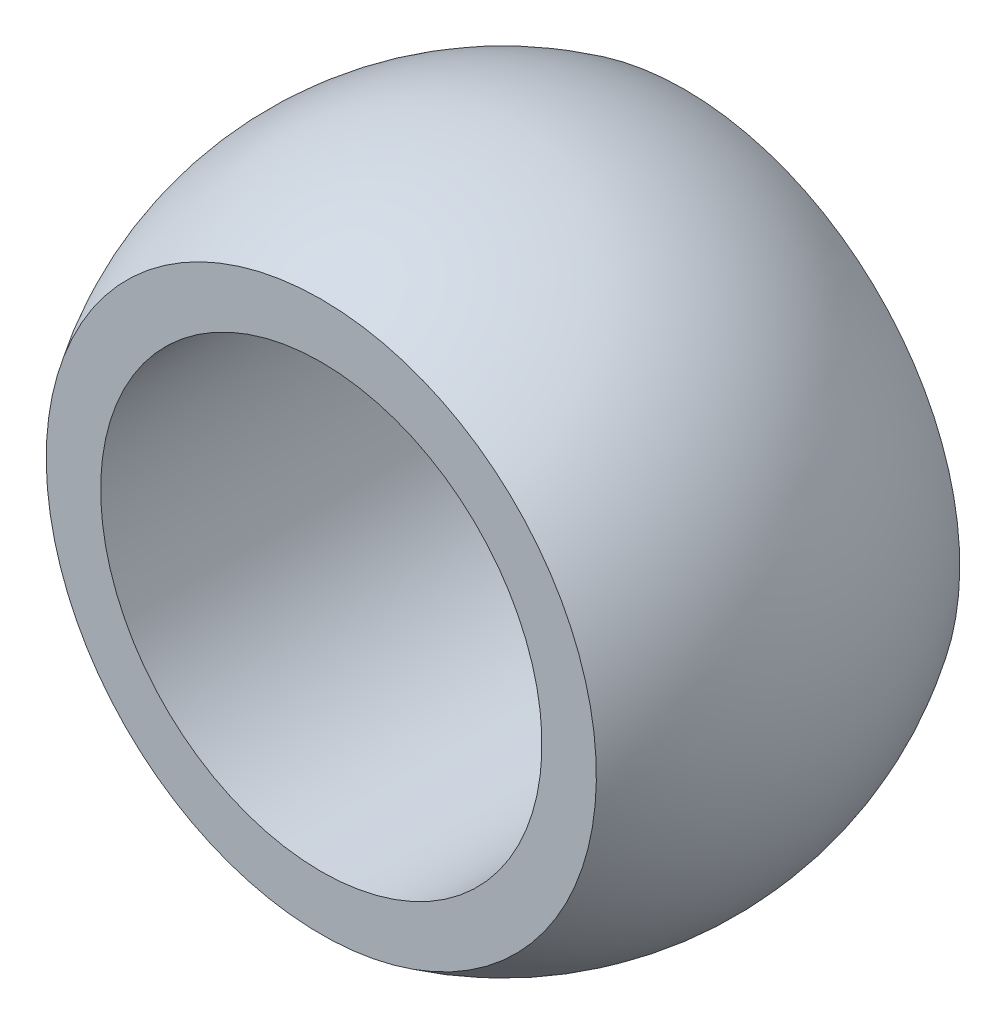
from build123d import *


with BuildPart() as part:
    # Sketch1 → Revolve1 (revolve)
    with BuildSketch(Plane(origin=(0, 0, 0), x_dir=(0, 0, -1), z_dir=(1, 0, 0))):
        with BuildLine():
            Line((7, 8.5), (-7, 8.5))
            Line((-7, 8.5), (-7, 10.596697599))
            ThreePointArc((-7, 10.596697599), (0, 12.7), (7, 10.596697599))
            Line((7, 10.596697599), (7, 8.5))
        make_face()
    revolve(axis=Axis((0, 0, -9.541553321), (0, 0, 1)))


solid = part.part
